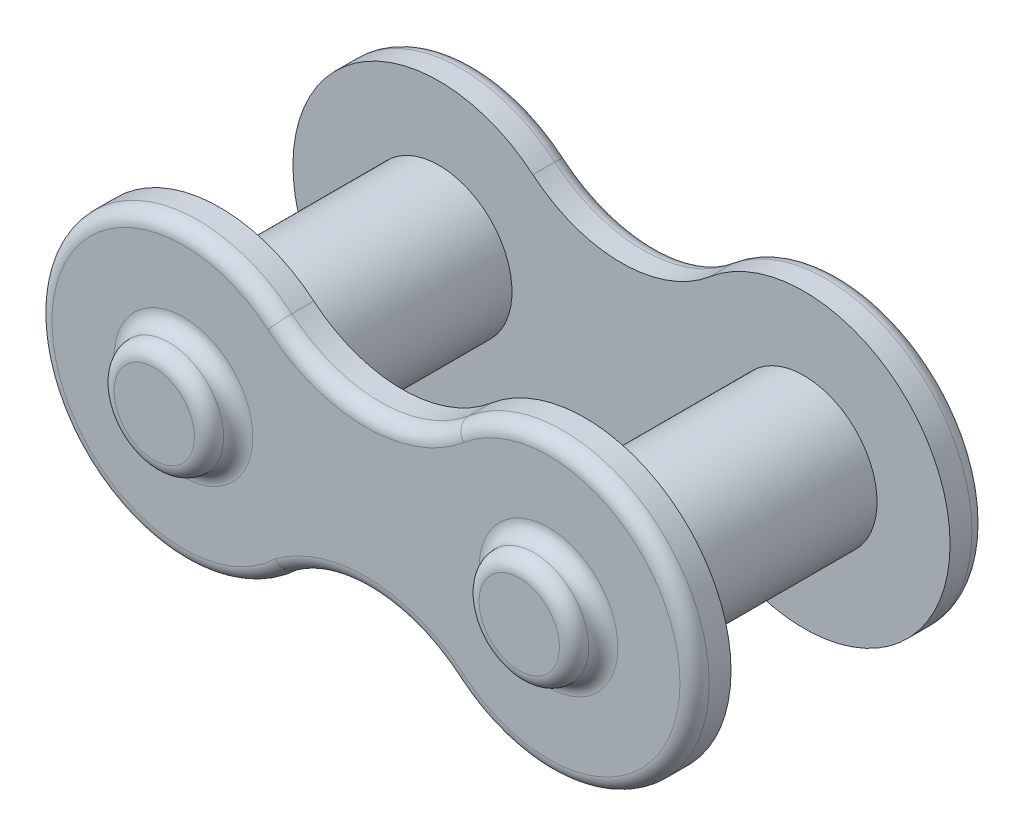
from build123d import *

# Parameters (mm, degrees)
BOSS_EXTRUDE1_DEPTH  = 1.27
SKETCH2_R            = 2.54
BOSS_EXTRUDE2_DEPTH  = 7.62
SKETCH3_R            = 1.905
BOSS_EXTRUDE3_DEPTH  = 1.016
FILLET1_R            = 0.508
FILLET2_R            = 0.508
FILLET1_OF_MIRROR3_R = 0.508
FILLET2_OF_MIRROR3_R = 0.508


with BuildPart() as part:
    # Sketch1 → Boss-Extrude1 (new body)
    with BuildSketch(Plane.XY):
        with BuildLine():
            ThreePointArc((-26.191844276, -6.037143701), (-34.535215397, -10.092878556), (-25.946396087, -13.599017422))
            ThreePointArc((-25.946396087, -13.599017422), (-22.954821865, -12.674647532), (-20.032282841, -13.798365326))
            ThreePointArc((-20.032282841, -13.798365326), (-11.677896645, -9.914450414), (-20.032282841, -6.030535502))
            ThreePointArc((-20.032282841, -6.030535502), (-23.110858628, -7.156966052), (-26.191844276, -6.037143701))
        make_face()
    boss_extrude1 = extrude(amount=BOSS_EXTRUDE1_DEPTH)

    # Sketch2 → Boss-Extrude2 (add)
    with BuildSketch(Plane.XY.offset(1.27)):
        with Locations(Location((-16.757896645, -9.914450414, 0), (0, 0, 180))):
            Circle(SKETCH2_R)
        with Locations(Location((-29.457889337, -9.928075423, 0), (0, 0, 180))):
            Circle(SKETCH2_R)
    extrude(amount=BOSS_EXTRUDE2_DEPTH)

    # Mirror1: Boss-Extrude1 across plane
    add(boss_extrude1.mirror(Plane.XY.offset(5.08)))

    # Sketch3 → Boss-Extrude3 (add)
    with BuildSketch(Plane(origin=(0, 0, 0), x_dir=(-1, 0, 0), z_dir=(0, 0, -1))):
        with Locations((29.457889337, -9.928075423)):
            Circle(SKETCH3_R)
        with Locations((16.757896645, -9.914450414)):
            Circle(SKETCH3_R)
    boss_extrude3 = extrude(amount=BOSS_EXTRUDE3_DEPTH)

    # Fillet1
    fillet1_edges = [part.edges().sort_by_distance(p)[0] for p in [
        (-27.552889337, -9.928075423, -1.016),
        (-14.852896645, -9.914450414, -1.016),
    ]]
    fillet(fillet1_edges, radius=FILLET1_R)

    # Fillet2
    fillet2_edges = [part.edges().sort_by_distance(p)[0] for p in [
        (-27.552889337, -9.928075423, 0),
    ]]
    fillet(fillet2_edges, radius=FILLET2_R - 0.0001)  # a hair under: the kernel refuses the full size
    fillet2_2_edges = [part.edges().sort_by_distance(p)[0] for p in [
        (-23.110858628, -7.156966052, 0),
        (-11.677896645, -9.914450414, 0),
        (-34.535215397, -10.092878556, 0),
        (-22.954821865, -12.674647532, 0),
    ]]
    fillet(fillet2_2_edges, radius=FILLET2_R)
    fillet2_3_edges = [part.edges().sort_by_distance(p)[0] for p in [
        (-14.852896645, -9.914450414, 0),
    ]]
    fillet(fillet2_3_edges, radius=FILLET2_R - 0.0001)  # a hair under: the kernel refuses the full size
    fillet2_4_edges = [part.edges().sort_by_distance(p)[0] for p in [
        (-23.110858628, -7.156966052, 10.16),
        (-11.677896645, -9.914450414, 10.16),
        (-34.535215397, -10.092878556, 10.16),
        (-22.954821865, -12.674647532, 10.16),
    ]]
    fillet(fillet2_4_edges, radius=FILLET2_R)

    # Mirror3: Boss-Extrude3 across plane
    add(boss_extrude3.mirror(Plane.XY.offset(5.08)))

    # Fillet1 of Mirror3
    fillet1_of_mirror3_edges = [part.edges().sort_by_distance(p)[0] for p in [
        (-27.552889337, -9.928075423, 11.176),
        (-14.852896645, -9.914450414, 11.176),
    ]]
    fillet(fillet1_of_mirror3_edges, radius=FILLET1_OF_MIRROR3_R)

    # Fillet2 of Mirror3
    fillet2_of_mirror3_edges = [part.edges().sort_by_distance(p)[0] for p in [
        (-27.552889337, -9.928075423, 10.16),
    ]]
    fillet(fillet2_of_mirror3_edges, radius=FILLET2_OF_MIRROR3_R - 0.0001)  # a hair under: the kernel refuses the full size
    fillet2_of_mirror3_2_edges = [part.edges().sort_by_distance(p)[0] for p in [
        (-14.852896645, -9.914450414, 10.16),
    ]]
    fillet(fillet2_of_mirror3_2_edges, radius=FILLET2_OF_MIRROR3_R - 0.0001)  # a hair under: the kernel refuses the full size


solid = part.part
